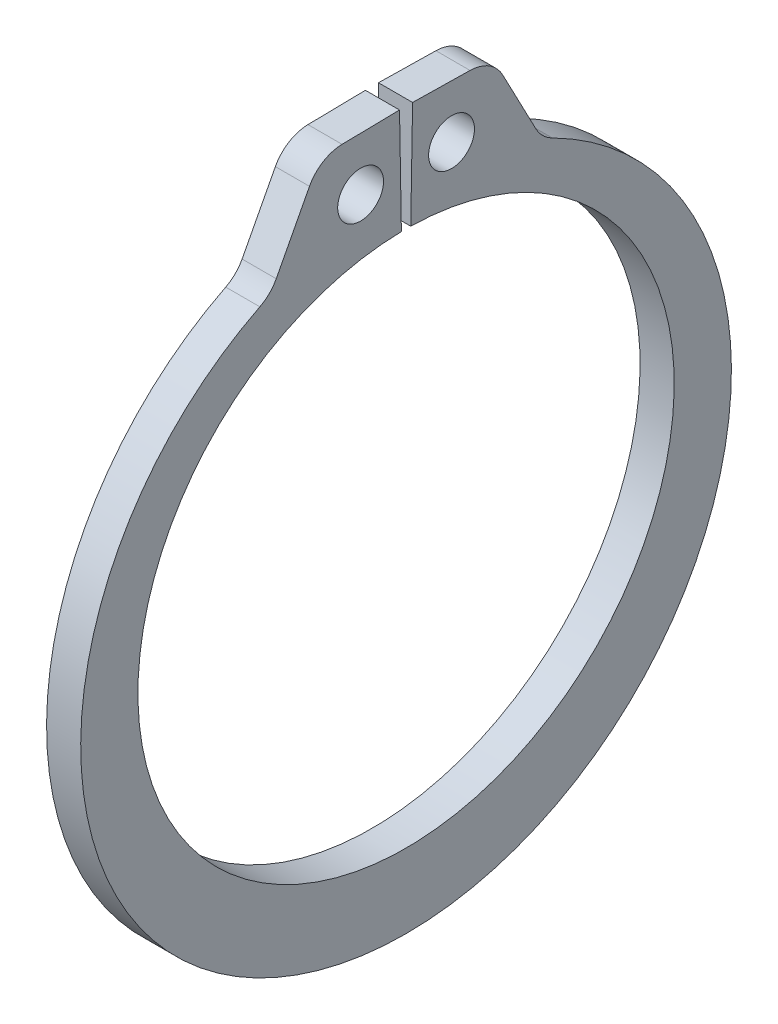
from build123d import *

# Parameters (mm, degrees)
SKETCH1_R      = 0.5969
EXTRUDE1_DEPTH = 0.4445
FILLET1_R      = 0.9779


with BuildPart() as part:
    # Sketch1 → Extrude1 (new, symmetric)
    with BuildSketch(Plane(origin=(0, 0, 0), x_dir=(0, 0, -1), z_dir=(1, 0, 0))):
        with BuildLine():
            Line((-0.121905059, 6.983936151), (-0.170223791, 9.752114479))
            Line((-0.170223791, 9.752114479), (-2.246357538, 9.71587543))
            Line((-2.246357538, 9.71587543), (-3.532146242, 7.263959166))
            ThreePointArc((-3.532146242, 7.263959166), (0, -8.9154), (3.532146242, 7.263959166))
            Line((3.532146242, 7.263959166), (2.246357538, 9.71587543))
            Line((2.246357538, 9.71587543), (0.170223791, 9.752114479))
            Line((0.170223791, 9.752114479), (0.121905059, 6.983936151))
            ThreePointArc((0.121905059, 6.983936151), (0, -6.985), (-0.121905059, 6.983936151))
        make_face()
        with Locations((-1.184131298, 8.34990579)):
            Circle(SKETCH1_R, mode=Mode.SUBTRACT)
        with Locations((1.184131298, 8.34990579)):
            Circle(SKETCH1_R, mode=Mode.SUBTRACT)
    extrude(amount=EXTRUDE1_DEPTH, both=True)

    # Fillet1
    fillet1_edges = [part.edges().sort_by_distance(p)[0] for p in [
        (0, 7.263959166, 3.532146242),
        (0, 7.263959166, -3.532146242),
        (0, 9.71587543, 2.246357538),
        (0, 9.71587543, -2.246357538),
    ]]
    fillet(fillet1_edges, radius=FILLET1_R)


solid = part.part
